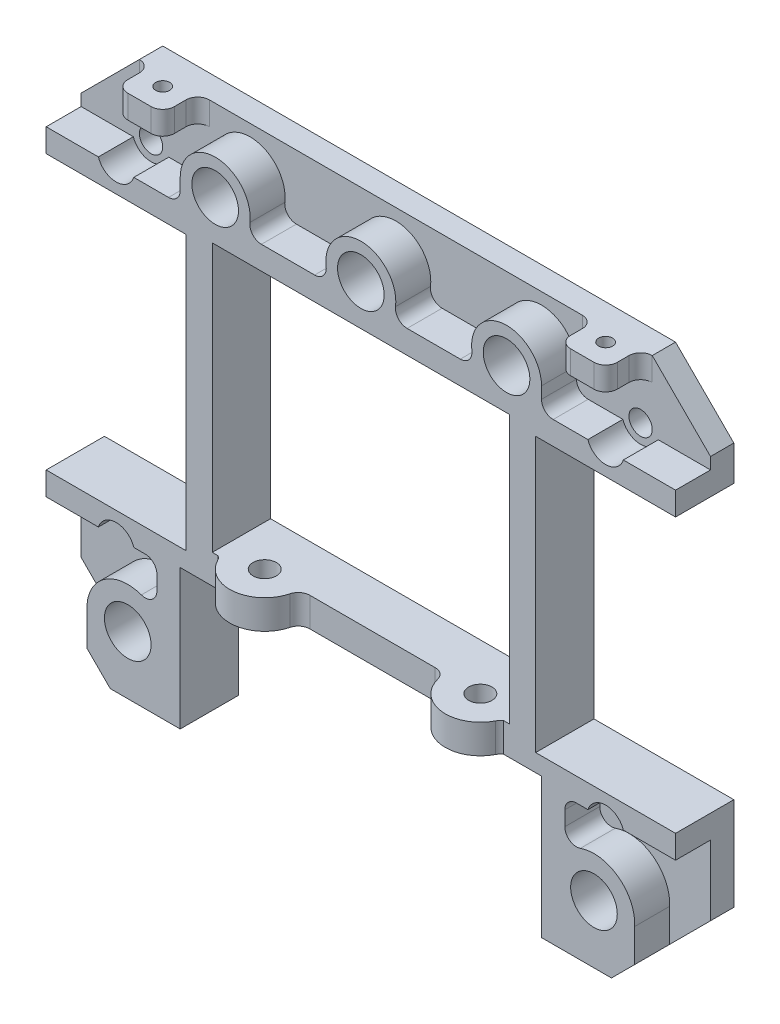
from build123d import *

# Parameters (mm, degrees)
SKETCH_1_R          = 2
SKETCH_1_R_2        = 1
SKETCH_1_W          = 25.5
SKETCH_1_H          = 23
EXTRUDE_1_DEPTH     = 2
SKETCH_3_R          = 1
EXTRUDE_2_DEPTH     = 2.5
SKETCH_4_R          = 2
SKETCH_4_W          = 4
SKETCH_4_H          = 2
EXTRUDE_3_DEPTH     = 3
FILLET_1_R          = 1
FILLET_2_R          = 1
SKETCH_5_W          = 12.5
SKETCH_5_H          = 2.5
EXTRUDE_4_DEPTH     = 2
FILLET_3_R          = 1
SKETCH_6_R          = 2
CUT_EXTRUDE_1_DEPTH = 1
SKETCH_7_R          = 0.75
CUT_EXTRUDE_2_DEPTH = 2.5
SKETCH_8_R          = 0.6
CUT_EXTRUDE_3_DEPTH = 3


with BuildPart() as part:
    # 草图1 → 凸台-拉伸1 (new body)
    with BuildSketch(Plane.XY):
        Polygon((-27, 25), (-15, 25), (-15, 1.5), (-27, 1.5), (-27, -6.5), (-21.5, -12), (-15.5, -12), (-15.5, 0), (15.5, 0), (15.5, -12), (21.5, -12), (27, -6.5), (27, 1.5), (15, 1.5), (15, 25), (27, 25), (27, 28), (22, 33), (-22, 33), (-27, 28), align=None)
        with Locations((20, -7)):
            Circle(SKETCH_1_R, mode=Mode.SUBTRACT)
        with Locations((12.5, 29)):
            Circle(SKETCH_1_R, mode=Mode.SUBTRACT)
        with Locations((0, 29)):
            Circle(SKETCH_1_R, mode=Mode.SUBTRACT)
        with Locations(Location((-20, -7, 0), (0, 0, 180))):
            Circle(SKETCH_1_R, mode=Mode.SUBTRACT)
        with Locations(Location((-12.5, 29, 0), (0, 0, 180))):
            Circle(SKETCH_1_R, mode=Mode.SUBTRACT)
        with Locations((21, 27.5)):
            Circle(SKETCH_1_R_2, mode=Mode.SUBTRACT)
        with Locations((21, -1)):
            Circle(SKETCH_1_R_2, mode=Mode.SUBTRACT)
        with Locations(Location((-21, 27.5, 0), (0, 0, 180))):
            Circle(SKETCH_1_R_2, mode=Mode.SUBTRACT)
        with Locations(Location((-21, -1, 0), (0, 0, 180))):
            Circle(SKETCH_1_R_2, mode=Mode.SUBTRACT)
        with Locations((0, 14)):
            Rectangle(SKETCH_1_W, SKETCH_1_H, mode=Mode.SUBTRACT)
    extrude(amount=EXTRUDE_1_DEPTH)

    # 草图3 → 凸台-拉伸2 (add)
    # profile 1 of 2: a face of its own
    with BuildSketch(Plane(origin=(0, 2.5, 0), x_dir=(1, 0, 0), z_dir=(0, 1, 0))):
        with BuildLine():
            Line((-6.25, -2), (-6.25, -4))
            ThreePointArc((-6.25, -4), (-9.25, -7), (-12.25, -4))
            Line((-12.25, -4), (-12.25, -2))
            Line((-12.25, -2), (-6.25, -2))
        make_face()
        with Locations(Location((-9.25, -4, 0), (0, 0, 180))):
            Circle(SKETCH_3_R, mode=Mode.SUBTRACT)
    # profile 2 of 2: a face of its own
    with BuildSketch(Plane(origin=(0, 2.5, 0), x_dir=(1, 0, 0), z_dir=(0, 1, 0))):
        with BuildLine():
            Line((12.25, -2), (6.25, -2))
            Line((6.25, -2), (6.25, -4))
            ThreePointArc((6.25, -4), (9.25, -7), (12.25, -4))
            Line((12.25, -4), (12.25, -2))
        make_face()
        with Locations((9.25, -4)):
            Circle(SKETCH_3_R, mode=Mode.SUBTRACT)
    extrude(amount=-EXTRUDE_2_DEPTH)

    # 草图4 → 凸台-拉伸3 (add)
    # profile 1 of 3: a face of its own
    with BuildSketch(Plane.XY.offset(2)):
        with BuildLine():
            Line((-15.5, 29), (-15.5, 27))
            Line((-15.5, 27), (-19.480131585, 27))
            ThreePointArc((-19.480131585, 27), (-21, 25.9), (-22.519868415, 27))
            Line((-22.519868415, 27), (-27, 27))
            Line((-27, 27), (-27, 25))
            Line((-27, 25), (-16.5, 25))
            Line((-16.5, 25), (-15, 25))
            Line((-15, 25), (-15, 1.5))
            Line((-15, 1.5), (-27, 1.5))
            Line((-27, 1.5), (-27, -0.5))
            Line((-27, -0.5), (-25, -0.5))
            Line((-25, -0.5), (-22.519868415, -0.5))
            ThreePointArc((-22.519868415, -0.5), (-21, 0.6), (-19.480131585, -0.5))
            Line((-19.480131585, -0.5), (-17.5, -0.5))
            Line((-17.5, -0.5), (-17.5, -4.550510257))
            ThreePointArc((-17.5, -4.550510257), (-21.403955533, -3.793926254), (-23.495572013, -7.176000862))
            Line((-23.495572013, -7.176000862), (-23.495572013, -10.004427987))
            Line((-23.495572013, -10.004427987), (-21.5, -12))
            Line((-21.5, -12), (-15.5, -12))
            Line((-15.5, -12), (-15.5, 0))
            Line((-15.5, 0), (-12.25, 0))
            Line((-12.25, 0), (-12.25, 2.5))
            Line((-12.25, 2.5), (-12.75, 2.5))
            Line((-12.75, 2.5), (-12.75, 25.5))
            Line((-12.75, 25.5), (12.75, 25.5))
            Line((12.75, 25.5), (12.75, 2.5))
            Line((12.75, 2.5), (12.25, 2.5))
            Line((12.25, 2.5), (12.25, 0))
            Line((12.25, 0), (15.5, 0))
            Line((15.5, 0), (15.5, -12))
            Line((15.5, -12), (21.5, -12))
            Line((21.5, -12), (23.495572013, -10.004427987))
            Line((23.495572013, -10.004427987), (23.495572013, -7.176000862))
            ThreePointArc((23.495572013, -7.176000862), (21.403955533, -3.793926254), (17.5, -4.550510257))
            Line((17.5, -4.550510257), (17.5, -0.5))
            Line((17.5, -0.5), (19.480131585, -0.5))
            ThreePointArc((19.480131585, -0.5), (21, 0.6), (22.519868415, -0.5))
            Line((22.519868415, -0.5), (25, -0.5))
            Line((25, -0.5), (27, -0.5))
            Line((27, -0.5), (27, 1.5))
            Line((27, 1.5), (15, 1.5))
            Line((15, 1.5), (15, 25))
            Line((15, 25), (16.5, 25))
            Line((16.5, 25), (27, 25))
            Line((27, 25), (27, 27))
            Line((27, 27), (22.519868415, 27))
            ThreePointArc((22.519868415, 27), (21, 25.9), (19.480131585, 27))
            Line((19.480131585, 27), (15.5, 27))
            Line((15.5, 27), (15.5, 29))
            ThreePointArc((15.5, 29), (11.723542865, 31.897777479), (9.901923789, 27.5))
            Line((9.901923789, 27.5), (2.598076211, 27.5))
            ThreePointArc((2.598076211, 27.5), (0, 32), (-2.598076211, 27.5))
            Line((-2.598076211, 27.5), (-9.901923789, 27.5))
            ThreePointArc((-9.901923789, 27.5), (-11.723542865, 31.897777479), (-15.5, 29))
        make_face()
        with Locations((20, -7)):
            Circle(SKETCH_4_R, mode=Mode.SUBTRACT)
        with Locations((12.5, 29)):
            Circle(SKETCH_4_R, mode=Mode.SUBTRACT)
        with Locations((0, 29)):
            Circle(SKETCH_4_R, mode=Mode.SUBTRACT)
        with Locations(Location((-12.5, 29, 0), (0, 0, 180))):
            Circle(SKETCH_4_R, mode=Mode.SUBTRACT)
        with Locations(Location((-20, -7, 0), (0, 0, 180))):
            Circle(SKETCH_4_R, mode=Mode.SUBTRACT)
    # profile 2 of 3: a face of its own
    with BuildSketch(Plane.XY.offset(2)):
        with Locations((-19, 32)):
            Rectangle(SKETCH_4_W, SKETCH_4_H)
    # profile 3 of 3: a face of its own
    with BuildSketch(Plane.XY.offset(2)):
        with Locations((19, 32)):
            Rectangle(SKETCH_4_W, SKETCH_4_H)
    extrude(amount=EXTRUDE_3_DEPTH)

    # 圆角1
    # the kernel refuses this fillet: 1 mm, written as the material it adds along each edge
    with BuildSketch(Plane(origin=(17.5, -4.550510257, 2), x_dir=(0, 1, 0), z_dir=(0, 0, 1))) as fillet_1_piece_1:
        with BuildLine():
            CenterArc((1.793150944, -1), FILLET_1_R, 90, 109.471220634)
            ThreePointArc((0.850341903, -1.333333333), (0.5014624, -0.618011305), (0, 0))
            Line((0, 0), (1.793150944, 0))
        make_face()
    extrude(amount=3)
    with BuildSketch(Plane(origin=(17.5, -0.5, 2), x_dir=(1, 0, 0), z_dir=(0, 0, 1)), Plane(origin=(15.5, 27, 2), x_dir=(0, 1, 0), z_dir=(0, 0, 1)), Plane(origin=(-15.5, 27, 2), x_dir=(-1, 0, 0), z_dir=(0, 0, 1)), Plane(origin=(-17.5, -0.5, 2), x_dir=(0, -1, 0), z_dir=(0, 0, 1))) as fillet_1_piece_2:
        with BuildLine():
            CenterArc((FILLET_1_R, -FILLET_1_R), FILLET_1_R, 90, 90)
            Line((0, -FILLET_1_R), (0, 0))
            Line((0, 0), (FILLET_1_R, 0))
        make_face()
    extrude(amount=3)
    with BuildSketch(Plane(origin=(9.901923789, 27.5, 2), x_dir=(-1, 0, 0), z_dir=(0, 0, 1)), Plane(origin=(-2.598076211, 27.5, 2), x_dir=(-1, 0, 0), z_dir=(0, 0, 1))) as fillet_1_piece_3:
        with BuildLine():
            CenterArc((1.370550755, -1), FILLET_1_R, 90, 97.180755781)
            ThreePointArc((0.378394014, -1.125), (0.245389674, -0.543599583), (0, 0))
            Line((0, 0), (1.370550755, 0))
        make_face()
    extrude(amount=3)
    with BuildSketch(Plane(origin=(2.598076211, 27.5, 2), x_dir=(0.31880013895525616, 0.9478219618694798, 0), z_dir=(0, 0, 1)), Plane(origin=(-9.901923789, 27.5, 2), x_dir=(0.3188001389552541, 0.9478219618694803, 0), z_dir=(0, 0, 1))) as fillet_1_piece_4:
        with BuildLine():
            CenterArc((1.384753733, -0.980237967), FILLET_1_R, 101.409622109, 97.180755781)
            Line((0.436931771, -1.299038106), (0, 0))
            ThreePointArc((0, 0), (0.593465886, -0.0592861), (1.186931771, 0))
        make_face()
    extrude(amount=3)
    with BuildSketch(Plane(origin=(-17.5, -4.550510257, 2), x_dir=(-0.8431291837491304, 0.5377110557823086, 0), z_dir=(0, 0, 1))) as fillet_1_piece_5:
        with BuildLine():
            CenterArc((1.807326271, -0.974146836), FILLET_1_R, 103.056735384, 109.471220635)
            Line((0.964197087, -1.511857892), (0, 0))
            ThreePointArc((0, 0), (0.790705244, -0.090486073), (1.581410487, 0))
        make_face()
    extrude(amount=3)
    with BuildSketch(Plane(origin=(-21, 33, 2), x_dir=(-1, 0, 0), z_dir=(0, -1, 0)), Plane(origin=(-17, 31, 2), x_dir=(1, 0, 0), z_dir=(0, 1, 0))) as fillet_1_piece_6:
        with BuildLine():
            CenterArc((FILLET_1_R, -FILLET_1_R), FILLET_1_R, 90, 90)
            Line((0, -FILLET_1_R), (0, 0))
            Line((0, 0), (FILLET_1_R, 0))
        make_face()
    extrude(amount=2)
    with BuildSketch(Plane(origin=(17, 31, 2), x_dir=(-1, 0, 0), z_dir=(0, 1, 0)), Plane(origin=(21, 33, 2), x_dir=(1, 0, 0), z_dir=(0, -1, 0))) as fillet_1_piece_7:
        with BuildLine():
            CenterArc((FILLET_1_R, FILLET_1_R), FILLET_1_R, 180, 90)
            Line((0, FILLET_1_R), (0, 0))
            Line((0, 0), (FILLET_1_R, 0))
        make_face()
    extrude(amount=2)
    # the kernel refuses this fillet: 1 mm, written as the material it takes off along each edge
    with BuildSketch(Plane(origin=(-21, 35.5, 5), x_dir=(0, 0, -1), z_dir=(0, -1, 0)), Plane(origin=(21, 35.5, 5), x_dir=(-1, 0, 0), z_dir=(0, -1, 0))) as fillet_1_2_piece_1:
        with BuildLine():
            CenterArc((FILLET_1_R, FILLET_1_R), FILLET_1_R, 180, 90)
            Line((0, FILLET_1_R), (0, 0))
            Line((0, 0), (FILLET_1_R, 0))
        make_face()
    extrude(amount=7, mode=Mode.SUBTRACT)
    with BuildSketch(Plane(origin=(-17, 28.5, 5), x_dir=(-1, 0, 0), z_dir=(0, 1, 0)), Plane(origin=(17, 28.5, 5), x_dir=(0, 0, -1), z_dir=(0, 1, 0))) as fillet_1_2_piece_2:
        with BuildLine():
            CenterArc((FILLET_1_R, -FILLET_1_R), FILLET_1_R, 90, 90)
            Line((0, -FILLET_1_R), (0, 0))
            Line((0, 0), (FILLET_1_R, 0))
        make_face()
    extrude(amount=7, mode=Mode.SUBTRACT)

    # 圆角2
    # the kernel refuses this fillet: 1 mm, written as the material it adds along each edge
    with BuildSketch(Plane(origin=(-12.25, 2.5, 4), x_dir=(0, 0, 1), z_dir=(0, -1, 0))) as fillet_2_piece_1:
        with BuildLine():
            CenterArc((1.830947502, 0.556350833), FILLET_2_R, 213.80380727, 28.955024372)
            ThreePointArc((1.373210626, -0.332736875), (0.706473859, -0.084370619), (0, 0))
            Line((0, 0), (1, 0))
        make_face()
    extrude(amount=2.5)
    with BuildSketch(Plane(origin=(12.25, 2.5, 4), x_dir=(0, 0, 1), z_dir=(0, -1, 0))) as fillet_2_piece_2:
        with BuildLine():
            CenterArc((1.830947502, -0.556350833), FILLET_2_R, 117.241168358, 28.955024372)
            ThreePointArc((1.373210626, 0.332736875), (0.706473859, 0.084370619), (0, 0))
            Line((0, 0), (1, 0))
        make_face()
    extrude(amount=2.5)

    # 草图5 → 凸台-拉伸4 (add)
    with BuildSketch(Plane.XY.offset(2)):
        with Locations((0, 1.25)):
            Rectangle(SKETCH_5_W, SKETCH_5_H)
    extrude(amount=EXTRUDE_4_DEPTH)

    # 圆角3
    fillet_3_edges = [part.edges().sort_by_distance(p)[0] for p in [
        (-6.25, 1.25, 4),
        (6.25, 1.25, 4),
    ]]
    fillet(fillet_3_edges, radius=FILLET_3_R)

    # 草图6 → 切除-拉伸1 (cut)
    with BuildSketch(Plane.XZ):
        with Locations((-9.25, 4)):
            Circle(SKETCH_6_R)
        with Locations((9.25, 4)):
            Circle(SKETCH_6_R)
    extrude(amount=-CUT_EXTRUDE_1_DEPTH, mode=Mode.SUBTRACT)

    # 草图7 → 切除-拉伸2 (cut)
    with BuildSketch(Plane.XZ.offset(12)):
        with Locations((19, 2.5)):
            Circle(SKETCH_7_R)
        with Locations(Location((-19, 2.5, 0), (0, 0, 180))):
            Circle(SKETCH_7_R)
    extrude(amount=-CUT_EXTRUDE_2_DEPTH, mode=Mode.SUBTRACT)

    # 草图8 → 切除-拉伸3 (cut)
    with BuildSketch(Plane(origin=(0, 33, 0), x_dir=(1, 0, 0), z_dir=(0, 1, 0))):
        with Locations(Location((-19, -3, 0), (0, 0, 180))):
            Circle(SKETCH_8_R)
        with Locations(Location((19, -3, 0), (0, 0, 270))):
            Circle(SKETCH_8_R)
    extrude(amount=-CUT_EXTRUDE_3_DEPTH, mode=Mode.SUBTRACT)


solid = part.part
